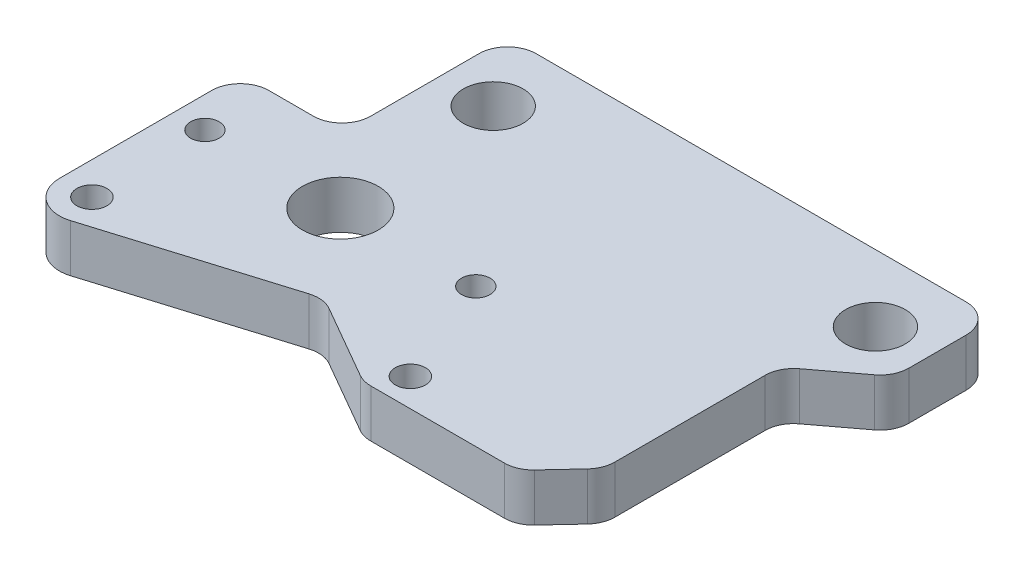
from build123d import *

# Parameters (mm, degrees)
SKETCH4_R           = 2
SKETCH4_R_2         = 1.89865
SKETCH4_R_3         = 5.04
SKETCH4_R_4         = 3.96875
BOSS_EXTRUDE2_DEPTH = 6.35


with BuildPart() as part:
    # Sketch4 → Boss-Extrude2 (new body)
    with BuildSketch(Plane(origin=(0, 0, 0), x_dir=(1, 0, 0), z_dir=(0, 1, 0))):
        with BuildLine():
            Line((22.483900583, -18.4375), (40.257702493, -18.4375))
            ThreePointArc((40.257702493, -18.4375), (41.776936446, -18.121498883), (43.044160097, -17.225913752))
            Line((43.044160097, -17.225913752), (46.444939319, -13.579024524))
            ThreePointArc((46.444939319, -13.579024524), (47.203372649, -12.376980446), (47.468481715, -10.980610773))
            Line((47.468481715, -10.980610773), (47.468481715, 8.985116992))
            ThreePointArc((47.468481715, 8.985116992), (47.868781798, 10.685130659), (48.985566477, 12.027918285))
            Line((48.985566477, 12.027918285), (54.680415238, 16.319294633))
            ThreePointArc((54.680415238, 16.319294633), (55.797199918, 17.662082259), (56.1975, 19.362095927))
            Line((56.1975, 19.362095927), (56.1975, 26.9875))
            ThreePointArc((56.1975, 26.9875), (55.081576836, 29.681576836), (52.3875, 30.7975))
            Line((52.3875, 30.7975), (-4.7625, 30.7975))
            ThreePointArc((-4.7625, 30.7975), (-7.456576836, 29.681576836), (-8.5725, 26.9875))
            Line((-8.5725, 26.9875), (-8.5725, 12.607500122))
            ThreePointArc((-8.5725, 12.607500122), (-9.688423164, 9.913423286), (-12.3825, 8.797500122))
            Line((-12.3825, 8.797500122), (-18.288, 8.797500122))
            ThreePointArc((-18.288, 8.797500122), (-20.982076836, 7.681576958), (-22.098, 4.987500122))
            Line((-22.098, 4.987500122), (-22.098, -15.24))
            ThreePointArc((-22.098, -15.24), (-20.348558836, -18.710969534), (-16.517810325, -19.369406885))
            Line((-16.517810325, -19.369406885), (7.765559219, -11.946980575))
            ThreePointArc((7.765559219, -11.946980575), (9.307944036, -11.804768953), (10.779476649, -12.288263354))
            Line((10.779476649, -12.288263354), (20.583679925, -17.929811531))
            ThreePointArc((20.583679925, -17.929811531), (21.500464498, -18.308390309), (22.483900583, -18.4375))
        make_face()
        with Locations((-17.78, -15.24)):
            Circle(SKETCH4_R, mode=Mode.SUBTRACT)
        with Locations((-18.000000004, 0)):
            Circle(SKETCH4_R_2, mode=Mode.SUBTRACT)
        Circle(SKETCH4_R_3, mode=Mode.SUBTRACT)
        with Locations((24.012521227, -14.703599027)):
            Circle(SKETCH4_R, mode=Mode.SUBTRACT)
        with Locations((18.000000004, 0)):
            Circle(SKETCH4_R_2, mode=Mode.SUBTRACT)
        with Locations((-1.5875, 21.9075)):
            Circle(SKETCH4_R_4, mode=Mode.SUBTRACT)
        with Locations((49.2125, 21.9075)):
            Circle(SKETCH4_R_4, mode=Mode.SUBTRACT)
    extrude(amount=-BOSS_EXTRUDE2_DEPTH)


solid = part.part
